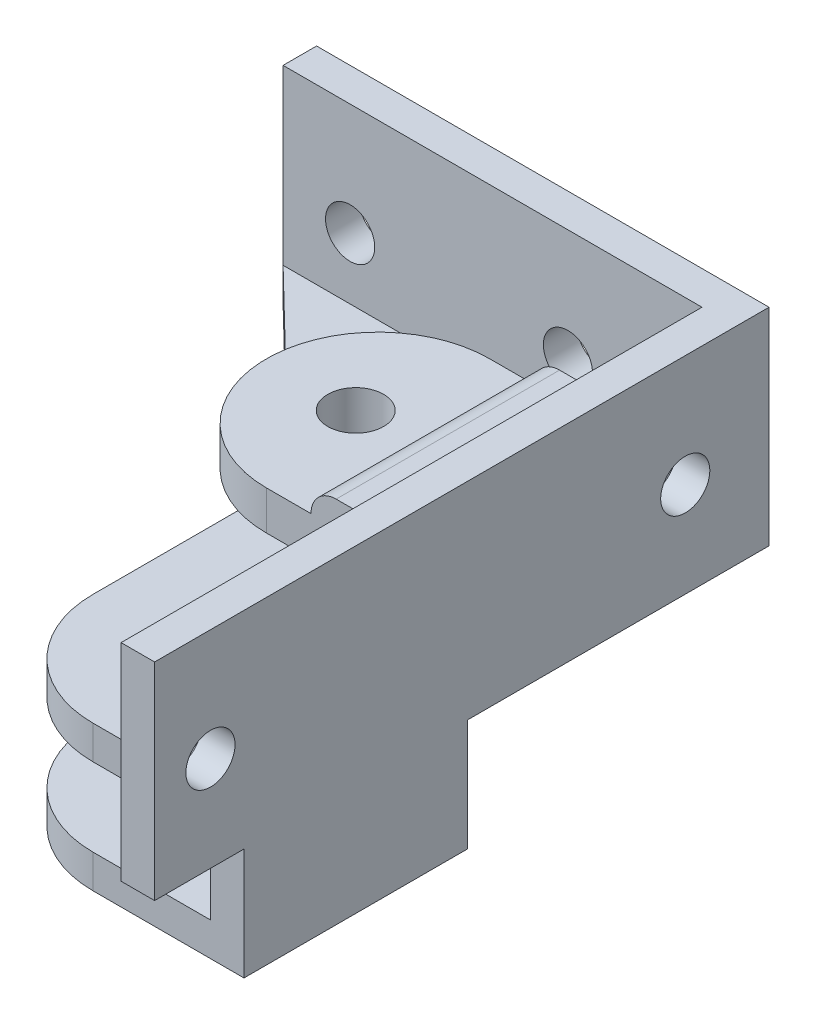
from build123d import *

# Parameters (mm, degrees)
BOSS_EXTRUDE1_DEPTH = 18.5
BOSS_EXTRUDE2_DEPTH = 3
BOSS_EXTRUDE3_START = 7
BOSS_EXTRUDE3_DEPTH = 3.5
SKETCH4_W           = 6.5
SKETCH4_H           = 2.25
BOSS_EXTRUDE4_DEPTH = 20
FILLET1_R           = 2.25
BOSS_EXTRUDE5_DEPTH = 7
BOSS_EXTRUDE6_START = 3
BOSS_EXTRUDE6_DEPTH = 3
SKETCH7_R           = 2.5
CUT_EXTRUDE1_DEPTH  = 73.232264259
SKETCH8_R           = 2.2
CUT_EXTRUDE2_DEPTH  = 71.763691255
CUT_EXTRUDE3_REACH  = 72.764
SKETCH9_R           = 2.2
BOSS_EXTRUDE7_REACH = 74.907
SKETCH10_R          = 3.5
SKETCH10_R_2        = 2.5
BOSS_EXTRUDE8_REACH = 72.039
SKETCH11_R          = 3.5
SKETCH11_R_2        = 2.5
CUT_EXTRUDE4_REACH  = 66.742
SKETCH12_W          = 7
SKETCH12_H          = 5


with BuildPart() as part:
    # Sketch1 → Boss-Extrude1 (new body)
    with BuildSketch(Plane(origin=(0, 0, 0), x_dir=(1, 0, 0), z_dir=(0, 1, 0))):
        Polygon((-40.5, 0), (0, 0), (0, -55), (-3, -55), (-3, -3), (-40.5, -3), align=None)
    extrude(amount=BOSS_EXTRUDE1_DEPTH)

    # Sketch2 → Boss-Extrude2 (add)
    with BuildSketch(Plane.XZ):
        with BuildLine():
            Line((-40.5, 3), (-23.5, 19.5))
            Line((-23.5, 19.5), (-23.5, 37))
            ThreePointArc((-23.5, 37), (-20.571067812, 44.071067812), (-13.5, 47))
            Line((-13.5, 47), (-3, 47))
            Line((-3, 47), (-3, 3))
            Line((-3, 3), (-40.5, 3))
        make_face()
    extrude(amount=-BOSS_EXTRUDE2_DEPTH)

    # Sketch3 → Boss-Extrude3 (add)
    with BuildSketch(Plane(origin=(0, 3, 0), x_dir=(1, 0, 0), z_dir=(0, 1, 0)).offset(BOSS_EXTRUDE3_START)):
        with BuildLine():
            Line((-3, -31.5), (-13.5, -31.5))
            ThreePointArc((-13.5, -31.5), (-23.5, -21.5), (-13.5, -11.5))
            Line((-13.5, -11.5), (-3, -11.5))
            Line((-3, -11.5), (-3, -31.5))
        make_face()
    extrude(amount=BOSS_EXTRUDE3_DEPTH)

    # Sketch4 → Boss-Extrude4 (add)
    with BuildSketch(Plane.XY.offset(31.5)):
        with Locations((-6.25, 14.625)):
            Rectangle(SKETCH4_W, SKETCH4_H)
    extrude(amount=-BOSS_EXTRUDE4_DEPTH)

    # Fillet1
    fillet1_edges = [part.edges().sort_by_distance(p)[0] for p in [
        (-9.5, 15.75, 21.5),
    ]]
    fillet(fillet1_edges, radius=FILLET1_R - 0.0001)  # a hair under: the kernel refuses the full size

    # Sketch5 → Boss-Extrude5 (add)
    with BuildSketch(Plane.XZ):
        Polygon((0, 47), (0, 27), (-9, 27), (-9, 29), (-3, 29), (-3, 47), align=None)
    extrude(amount=BOSS_EXTRUDE5_DEPTH)

    # Sketch6 → Boss-Extrude6 (add)
    with BuildSketch(Plane.XZ.offset(7).offset(BOSS_EXTRUDE6_START)):
        with BuildLine():
            Line((0, 27), (0, 47))
            Line((0, 47), (-13.5, 47))
            ThreePointArc((-13.5, 47), (-23.5, 37), (-13.5, 27))
            Line((-13.5, 27), (0, 27))
        make_face()
    extrude(amount=-BOSS_EXTRUDE6_DEPTH)

    # Sketch7 → Cut-Extrude1 (cut, through all)
    with BuildSketch(Plane(origin=(0, 13.5, 0), x_dir=(1, 0, 0), z_dir=(0, 1, 0))):
        with Locations(Location((-15.5, -21.5, 0), (0, 0, 270))):
            Circle(SKETCH7_R)
        with Locations(Location((-15.5, -37, 0), (0, 0, 270))):
            Circle(SKETCH7_R)
    extrude(amount=-CUT_EXTRUDE1_DEPTH, mode=Mode.SUBTRACT)

    # Sketch8 → Cut-Extrude2 (cut, through all)
    with BuildSketch(Plane(origin=(0, 0, 0), x_dir=(0, 0, -1), z_dir=(1, 0, 0))):
        with Locations((-50, 8.5)):
            Circle(SKETCH8_R)
        with Locations((-7.5, 8.5)):
            Circle(SKETCH8_R)
    extrude(amount=-CUT_EXTRUDE2_DEPTH, mode=Mode.SUBTRACT)

    # Sketch9 → Cut-Extrude3 (cut, up to next)
    with BuildSketch(Plane(origin=(0, 0, 0), x_dir=(-1, 0, 0), z_dir=(0, 0, -1)), mode=Mode.PRIVATE) as cut_extrude3_sk1:
        with Locations((15, 8.5)):
            Circle(SKETCH9_R)
    cut_extrude3_tool1 = extrude(cut_extrude3_sk1.sketch, amount=-CUT_EXTRUDE3_REACH, mode=Mode.PRIVATE) & part.part
    # Sketch9 → Cut-Extrude3 (cut, up to next)
    with BuildSketch(Plane(origin=(0, 0, 0), x_dir=(-1, 0, 0), z_dir=(0, 0, -1)), mode=Mode.PRIVATE) as cut_extrude3_sk2:
        with Locations((34.5, 8.5)):
            Circle(SKETCH9_R)
    cut_extrude3_tool2 = extrude(cut_extrude3_sk2.sketch, amount=-CUT_EXTRUDE3_REACH, mode=Mode.PRIVATE) & part.part
    add(cut_extrude3_tool1.solids().sort_by_distance((-15, 8.5, 0))[0], mode=Mode.SUBTRACT)
    add(cut_extrude3_tool2.solids().sort_by_distance((-34.5, 8.5, 0))[0], mode=Mode.SUBTRACT)

    # Sketch10 → Boss-Extrude7 (add, up to next)
    with BuildSketch(Plane(origin=(0, -7, 0), x_dir=(1, 0, 0), z_dir=(0, 1, 0)), mode=Mode.PRIVATE) as boss_extrude7_sk1:
        with Locations(Location((-15.5, -37, 0), (0, 0, 90))):
            Circle(SKETCH10_R)
        with Locations(Location((-15.5, -37, 0), (0, 0, 270))):
            Circle(SKETCH10_R_2, mode=Mode.SUBTRACT)
    boss_extrude7_tool1 = extrude(boss_extrude7_sk1.sketch, amount=BOSS_EXTRUDE7_REACH, mode=Mode.PRIVATE) - part.part
    add(boss_extrude7_tool1.solids().sort_by_distance((-15.5, -7, 40.401005))[0])

    # Sketch11 → Boss-Extrude8 (add, up to next)
    with BuildSketch(Plane(origin=(0, 3, 0), x_dir=(1, 0, 0), z_dir=(0, 1, 0)), mode=Mode.PRIVATE) as boss_extrude8_sk1:
        with Locations(Location((-15.5, -21.5, 0), (0, 0, 90))):
            Circle(SKETCH11_R)
        with Locations(Location((-15.5, -21.5, 0), (0, 0, 270))):
            Circle(SKETCH11_R_2, mode=Mode.SUBTRACT)
    boss_extrude8_tool1 = extrude(boss_extrude8_sk1.sketch, amount=BOSS_EXTRUDE8_REACH, mode=Mode.PRIVATE) - part.part
    add(boss_extrude8_tool1.solids().sort_by_distance((-15.5, 3, 24.901005))[0])

    # Cut-Extrude4: up to this face of the body (flat: up to its plane)
    cut_extrude4_end = Plane(part.part.faces().sort_by_distance((-21.584376674, 10.874217494, 3))[0])
    # Sketch12 → Cut-Extrude4 (cut, up to the picked face)
    with BuildSketch(Plane.XY.offset(47), mode=Mode.PRIVATE) as cut_extrude4_sk1:
        with Locations((-15.5, -3.5)):
            Rectangle(SKETCH12_W, SKETCH12_H)
    cut_extrude4_tool1 = split(extrude(cut_extrude4_sk1.sketch, amount=-CUT_EXTRUDE4_REACH, mode=Mode.PRIVATE), bisect_by=cut_extrude4_end, keep=Keep.BOTH, mode=Mode.PRIVATE)
    # Sketch12 → Cut-Extrude4 (cut, up to the picked face)
    with BuildSketch(Plane.XY.offset(47), mode=Mode.PRIVATE) as cut_extrude4_sk2:
        with Locations((-15.5, 6.5)):
            Rectangle(SKETCH12_W, SKETCH12_H)
    cut_extrude4_tool2 = split(extrude(cut_extrude4_sk2.sketch, amount=-CUT_EXTRUDE4_REACH, mode=Mode.PRIVATE), bisect_by=cut_extrude4_end, keep=Keep.BOTH, mode=Mode.PRIVATE)
    add(cut_extrude4_tool1.solids().sort_by(Axis((-15.5, -3.5, 47), (0, 0, -1)))[0], mode=Mode.SUBTRACT)
    add(cut_extrude4_tool2.solids().sort_by(Axis((-15.5, 6.5, 47), (0, 0, -1)))[0], mode=Mode.SUBTRACT)


solid = part.part
